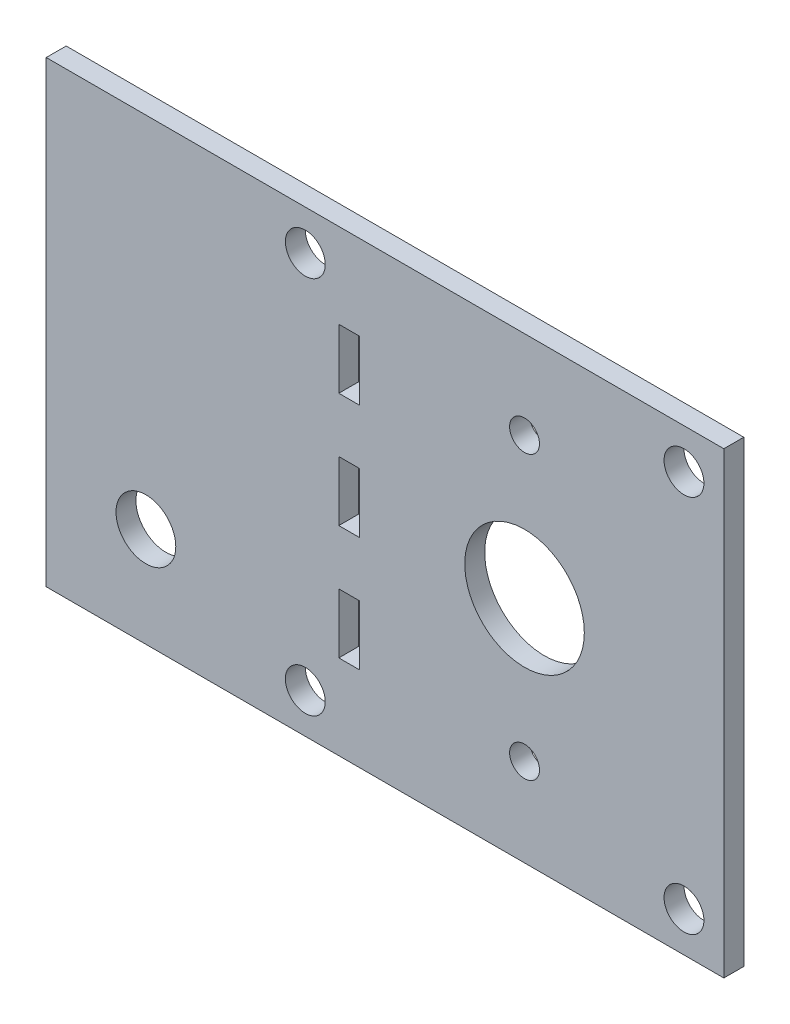
from build123d import *

# Parameters (mm, degrees)
SKETCH1_W           = 215.9
SKETCH1_H           = 146.05
SKETCH1_R           = 6.35
SKETCH1_R_2         = 19.05
SKETCH1_R_3         = 4.7625
SKETCH1_W_2         = 6.604
SKETCH1_H_2         = 19.05
BOSS_EXTRUDE1_DEPTH = 3.175
SKETCH2_R           = 9.525
CUT_EXTRUDE1_DEPTH  = 170.111599617


with BuildPart() as part:
    # Sketch1 → Boss-Extrude1 (new, symmetric)
    with BuildSketch(Plane.XY):
        with Locations((-44.45, 0)):
            Rectangle(SKETCH1_W, SKETCH1_H)
        with Locations((50.8, 60.325)):
            Circle(SKETCH1_R, mode=Mode.SUBTRACT)
        with Locations((50.8, -60.325)):
            Circle(SKETCH1_R, mode=Mode.SUBTRACT)
        Circle(SKETCH1_R_2, mode=Mode.SUBTRACT)
        with Locations((0, 45)):
            Circle(SKETCH1_R_3, mode=Mode.SUBTRACT)
        with Locations((0, -45)):
            Circle(SKETCH1_R_3, mode=Mode.SUBTRACT)
        with Locations((-69.85, 60.325)):
            Circle(SKETCH1_R, mode=Mode.SUBTRACT)
        with Locations((-69.85, -60.325)):
            Circle(SKETCH1_R, mode=Mode.SUBTRACT)
        with Locations((-55.88, 0)):
            Rectangle(SKETCH1_W_2, SKETCH1_H_2, mode=Mode.SUBTRACT)
        with Locations((-55.88, 36.5125)):
            Rectangle(SKETCH1_W_2, SKETCH1_H_2, mode=Mode.SUBTRACT)
        with Locations((-55.88, -36.5125)):
            Rectangle(SKETCH1_W_2, SKETCH1_H_2, mode=Mode.SUBTRACT)
    extrude(amount=BOSS_EXTRUDE1_DEPTH, both=True)

    # Sketch2 → Cut-Extrude1 (cut, through all)
    with BuildSketch(Plane.XY.offset(3.175)):
        with Locations((-120.65, -41.275)):
            Circle(SKETCH2_R)
    extrude(amount=-CUT_EXTRUDE1_DEPTH, mode=Mode.SUBTRACT)


solid = part.part
